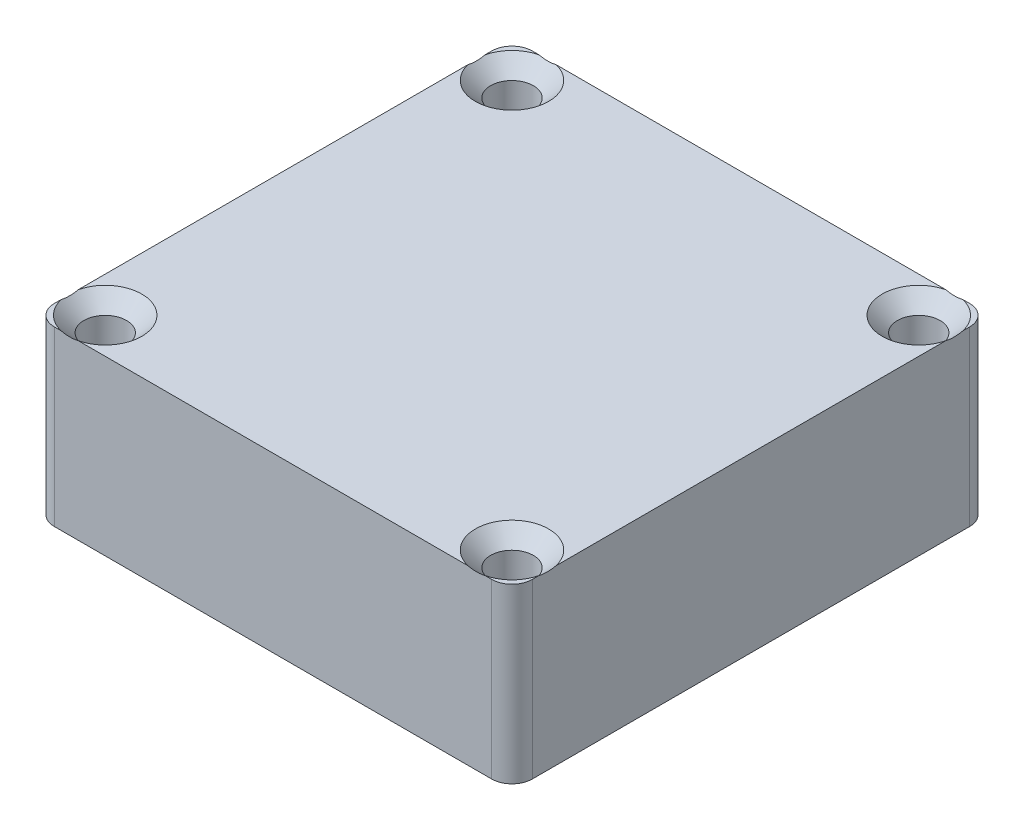
from build123d import *

# Parameters (mm, degrees)
SKETCH_1_W          = 47
SKETCH_1_H          = 47
EXTRUDE_1_DEPTH     = 17
SKETCH_2_R          = 2.1
CUT_EXTRUDE_1_DEPTH = 69.607579756
SKETCH_3_W          = 34.6
SKETCH_3_H          = 34.6
CUT_EXTRUDE_2_DEPTH = 14.25
FILLET_1_R          = 2
FILLET_2_R          = 1.5
CHAMFER_1_SIZE      = 1.5
FILLET_3_R          = 1.5


with BuildPart() as part:
    # Эскиз1 → Бобышка-Вытянуть1 (new body)
    with BuildSketch(Plane(origin=(0, 0, 0), x_dir=(1, 0, 0), z_dir=(0, 1, 0))):
        with Locations((-23.5, 23.5)):
            Rectangle(SKETCH_1_W, SKETCH_1_H)
    extrude(amount=EXTRUDE_1_DEPTH)

    # Эскиз2 → Вырез-Вытянуть1 (cut, through all)
    with BuildSketch(Plane.XZ):
        with Locations(Location((-43.5, -3.5, 0), (0, 0, 270))):
            Circle(SKETCH_2_R)
        with Locations(Location((-3.5, -3.5, 0), (0, 0, 90))):
            Circle(SKETCH_2_R)
        with Locations(Location((-3.5, -43.5, 0), (0, 0, 270))):
            Circle(SKETCH_2_R)
        with Locations(Location((-43.5, -43.5, 0), (0, 0, 90))):
            Circle(SKETCH_2_R)
    extrude(amount=-CUT_EXTRUDE_1_DEPTH, mode=Mode.SUBTRACT)

    # Эскиз3 → Вырез-Вытянуть2 (cut)
    with BuildSketch(Plane.XZ):
        with Locations((-23.5, -23.5)):
            Rectangle(SKETCH_3_W, SKETCH_3_H)
    extrude(amount=-CUT_EXTRUDE_2_DEPTH, mode=Mode.SUBTRACT)

    # Скругление1
    fillet_1_edges = [part.edges().sort_by_distance(p)[0] for p in [
        (0, 8.5, 0),
        (-47, 8.5, 0),
        (-47, 8.5, -47),
        (0, 8.5, -47),
    ]]
    fillet(fillet_1_edges, radius=FILLET_1_R)

    # Скругление2
    fillet_2_edges = [part.edges().sort_by_distance(p)[0] for p in [
        (-40.8, 14.25, -23.5),
        (-23.5, 14.25, -6.2),
        (-6.2, 14.25, -23.5),
        (-23.5, 14.25, -40.8),
    ]]
    fillet(fillet_2_edges, radius=FILLET_2_R)

    # Фаска1
    # the kernel refuses this chamfer: 1.5 mm, written as the material it takes off along each edge
    with BuildSketch(Plane(origin=(-43.5, 17, -43.5), x_dir=(0, 0, 1), z_dir=(1, 0, 0))) as chamfer_1_piece_1:
        Polygon((2.1, CHAMFER_1_SIZE), (2.1 + CHAMFER_1_SIZE, 0), (2.1, 0), align=None)
    revolve(axis=Axis((-43.5, 17, -43.5), (0, -1, 0)), mode=Mode.SUBTRACT)
    with BuildSketch(Plane(origin=(-3.5, 17, -43.5), x_dir=(0, 0, -1), z_dir=(-1, 0, 0))) as chamfer_1_piece_2:
        Polygon((2.1, CHAMFER_1_SIZE), (2.1 + CHAMFER_1_SIZE, 0), (2.1, 0), align=None)
    revolve(axis=Axis((-3.5, 17, -43.5), (0, -1, 0)), mode=Mode.SUBTRACT)
    with BuildSketch(Plane(origin=(-3.5, 17, -3.5), x_dir=(0, 0, 1), z_dir=(1, 0, 0))) as chamfer_1_piece_3:
        Polygon((2.1, CHAMFER_1_SIZE), (2.1 + CHAMFER_1_SIZE, 0), (2.1, 0), align=None)
    revolve(axis=Axis((-3.5, 17, -3.5), (0, -1, 0)), mode=Mode.SUBTRACT)
    with BuildSketch(Plane(origin=(-43.5, 17, -3.5), x_dir=(0, 0, -1), z_dir=(-1, 0, 0))) as chamfer_1_piece_4:
        Polygon((2.1, CHAMFER_1_SIZE), (2.1 + CHAMFER_1_SIZE, 0), (2.1, 0), align=None)
    revolve(axis=Axis((-43.5, 17, -3.5), (0, -1, 0)), mode=Mode.SUBTRACT)

    # Скругление3
    # the kernel refuses this fillet: 1.5 mm, written as the material it adds along each edge
    with BuildSketch(Plane(origin=(-39.3, 12.75, -39.3), x_dir=(0, 0, -1), z_dir=(-1, 0, 0))) as fillet_3_piece_1_section:
        Polygon((0, 0), (FILLET_3_R, 0), (FILLET_3_R, -FILLET_3_R), (0, -FILLET_3_R), align=None)
    fillet_3_piece_1 = extrude(amount=FILLET_3_R, mode=Mode.PRIVATE)
    fillet_3_piece_1 = fillet_3_piece_1 - Plane(origin=(-39.3, 12.75, -39.3), x_dir=(0, -0.7071067811865475, 0.7071067811865475), z_dir=(-1, 0, 0)) * Sphere(FILLET_3_R, mode=Mode.PRIVATE)
    add(fillet_3_piece_1)
    with BuildSketch(Plane(origin=(-39.3, 12.75, -7.7), x_dir=(0, 0, 1), z_dir=(-1, 0, 0))) as fillet_3_piece_2_section:
        Polygon((0, 0), (FILLET_3_R, 0), (FILLET_3_R, FILLET_3_R), (0, FILLET_3_R), align=None)
    fillet_3_piece_2 = extrude(amount=FILLET_3_R, mode=Mode.PRIVATE)
    fillet_3_piece_2 = fillet_3_piece_2 - Plane(origin=(-39.3, 12.75, -7.7), x_dir=(0, -0.7071067811865475, -0.7071067811865475), z_dir=(-1, 0, 0)) * Sphere(FILLET_3_R, mode=Mode.PRIVATE)
    add(fillet_3_piece_2)
    with BuildSketch(Plane(origin=(-7.7, 12.75, -39.3), x_dir=(1, 0, 0), z_dir=(0, 0, -1))) as fillet_3_piece_3_section:
        Polygon((0, 0), (FILLET_3_R, 0), (FILLET_3_R, -FILLET_3_R), (0, -FILLET_3_R), align=None)
    fillet_3_piece_3 = extrude(amount=FILLET_3_R, mode=Mode.PRIVATE)
    fillet_3_piece_3 = fillet_3_piece_3 - Plane(origin=(-7.7, 12.75, -39.3), x_dir=(-0.7071067811865475, -0.7071067811865475, 0), z_dir=(0, 0, -1)) * Sphere(FILLET_3_R, mode=Mode.PRIVATE)
    add(fillet_3_piece_3)
    with BuildSketch(Plane(origin=(-7.7, 12.75, -7.7), x_dir=(1, 0, 0), z_dir=(0, 0, 1))) as fillet_3_piece_4_section:
        Polygon((0, 0), (FILLET_3_R, 0), (FILLET_3_R, FILLET_3_R), (0, FILLET_3_R), align=None)
    fillet_3_piece_4 = extrude(amount=FILLET_3_R, mode=Mode.PRIVATE)
    fillet_3_piece_4 = fillet_3_piece_4 - Plane(origin=(-7.7, 12.75, -7.7), x_dir=(-0.7071067811865475, -0.7071067811865475, 0), z_dir=(0, 0, 1)) * Sphere(FILLET_3_R, mode=Mode.PRIVATE)
    add(fillet_3_piece_4)
    with BuildSketch(Plane(origin=(-6.2, 0, -6.2), x_dir=(-1, 0, 0), z_dir=(0, 1, 0)), Plane(origin=(-40.8, 0, -6.2), x_dir=(0, 0, -1), z_dir=(0, 1, 0))) as fillet_3_piece_5:
        with BuildLine():
            CenterArc((FILLET_3_R, -FILLET_3_R), FILLET_3_R, 90, 90)
            Line((0, -FILLET_3_R), (0, 0))
            Line((0, 0), (FILLET_3_R, 0))
        make_face()
    extrude(amount=12.75)
    with BuildSketch(Plane(origin=(-6.2, 0, -40.8), x_dir=(-1, 0, 0), z_dir=(0, 1, 0)), Plane(origin=(-40.8, 0, -40.8), x_dir=(0, 0, 1), z_dir=(0, 1, 0))) as fillet_3_piece_6:
        with BuildLine():
            CenterArc((FILLET_3_R, FILLET_3_R), FILLET_3_R, 180, 90)
            Line((0, FILLET_3_R), (0, 0))
            Line((0, 0), (FILLET_3_R, 0))
        make_face()
    extrude(amount=12.75)


solid = part.part
